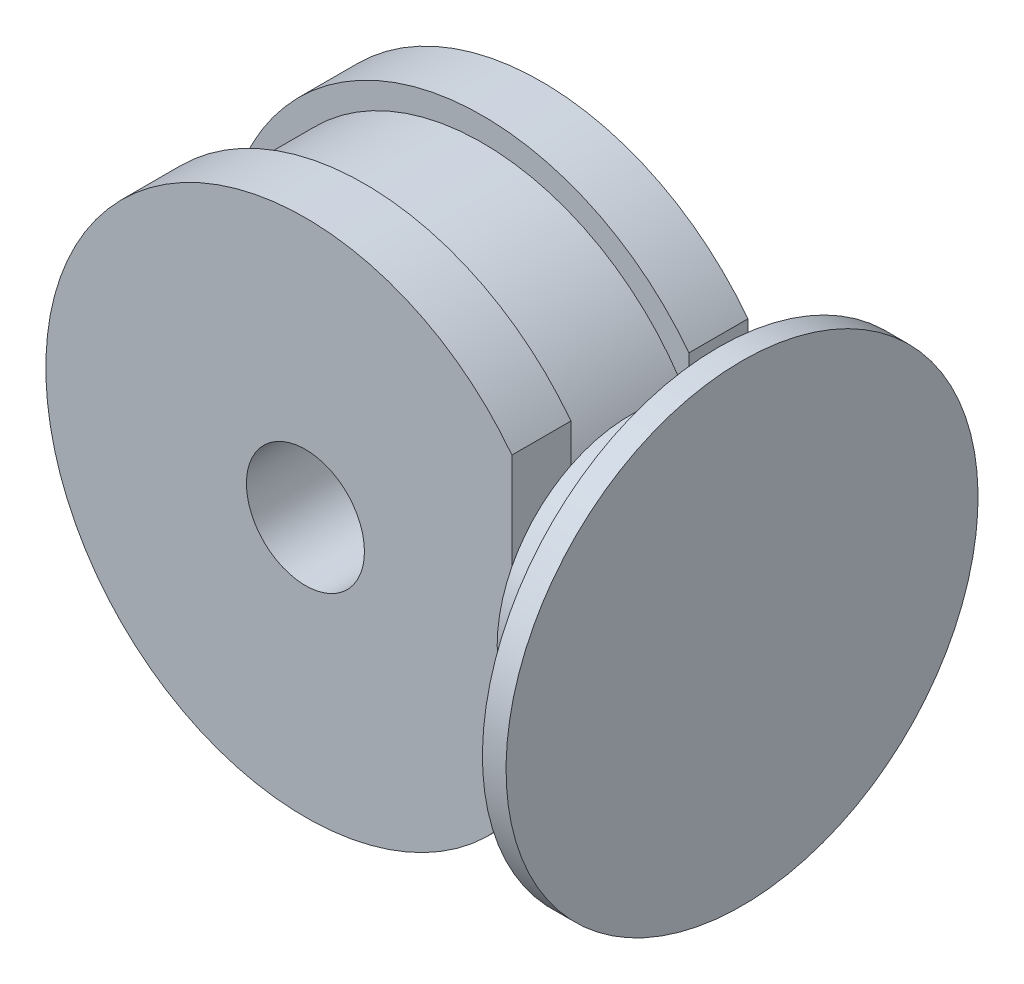
from build123d import *

# Parameters (mm, degrees)
ESQUISSE1_R             = 44
BOSS_EXTRU_1_DEPTH      = 10
ESQUISSE2_R             = 40
BOSS_EXTRU_2_DEPTH      = 20
ESQUISSE3_R             = 44
BOSS_EXTRU_3_DEPTH      = 10
ESQUISSE5_W             = 32.472445712
ESQUISSE5_H             = 94.731646138
ENL_V_MAT_EXTRU_2_DEPTH = 74.972968036
ESQUISSE4_R             = 10
ENL_V_MAT_EXTRU_1_DEPTH = 74.972968036
SKETCH1_R               = 22.5
BOSS_EXTRUDE1_DEPTH     = 15
SKETCH2_R               = 40
BOSS_EXTRUDE2_DEPTH     = 4


with BuildPart() as part:
    # Esquisse1 → Boss.-Extru.1 (new body)
    with BuildSketch(Plane.XY):
        Circle(ESQUISSE1_R)
    extrude(amount=BOSS_EXTRU_1_DEPTH)

    # Esquisse2 → Boss.-Extru.2 (add)
    with BuildSketch(Plane.XY.offset(10)):
        Circle(ESQUISSE2_R)
    extrude(amount=BOSS_EXTRU_2_DEPTH)

    # Esquisse3 → Boss.-Extru.3 (add)
    with BuildSketch(Plane.XY.offset(30)):
        Circle(ESQUISSE3_R)
    extrude(amount=BOSS_EXTRU_3_DEPTH)

    # Esquisse5 → Enlèv. mat.-Extru.2 (cut, through all)
    with BuildSketch(Plane.XY.offset(40)):
        with Locations((51.236222856, -3.296075317)):
            Rectangle(ESQUISSE5_W, ESQUISSE5_H)
    extrude(amount=-ENL_V_MAT_EXTRU_2_DEPTH, mode=Mode.SUBTRACT)

    # Esquisse4 → Enlèv. mat.-Extru.1 (cut, through all)
    with BuildSketch(Plane.XY.offset(40)):
        Circle(ESQUISSE4_R)
    extrude(amount=-ENL_V_MAT_EXTRU_1_DEPTH, mode=Mode.SUBTRACT)

    # Sketch1 → Boss-Extrude1 (add)
    with BuildSketch(Plane(origin=(35, 0, 0), x_dir=(0, 0, -1), z_dir=(1, 0, 0))):
        with Locations((-20, 0)):
            Circle(SKETCH1_R)
    extrude(amount=BOSS_EXTRUDE1_DEPTH)

    # Sketch2 → Boss-Extrude2 (add)
    with BuildSketch(Plane(origin=(50, 0, 0), x_dir=(0, 0, -1), z_dir=(1, 0, 0))):
        with Locations((-20, 0)):
            Circle(SKETCH2_R)
    extrude(amount=BOSS_EXTRUDE2_DEPTH)


solid = part.part
